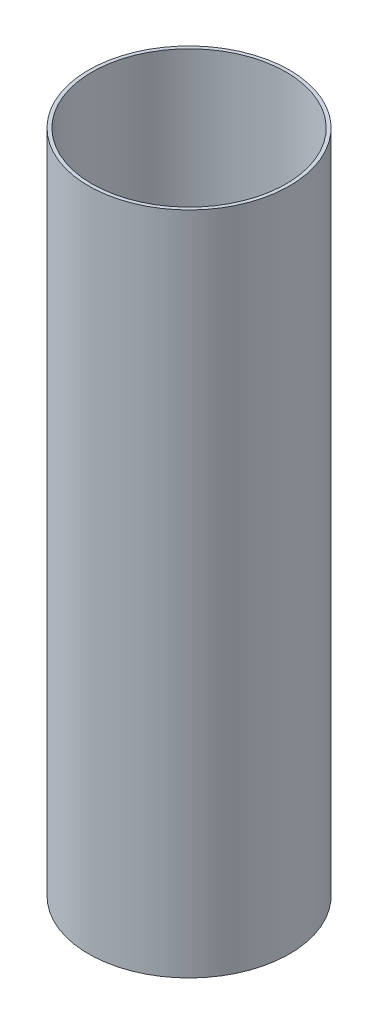
from build123d import *

# Parameters (mm, degrees)
SKETCH1_R           = 92.075
SKETCH1_R_2         = 88.9
BOSS_EXTRUDE1_DEPTH = 609.6


with BuildPart() as part:
    # Sketch1 → Boss-Extrude1 (new body)
    with BuildSketch(Plane(origin=(0, 0, 0), x_dir=(1, 0, 0), z_dir=(0, 1, 0))):
        Circle(SKETCH1_R)
        Circle(SKETCH1_R_2, mode=Mode.SUBTRACT)
    extrude(amount=BOSS_EXTRUDE1_DEPTH)


solid = part.part
